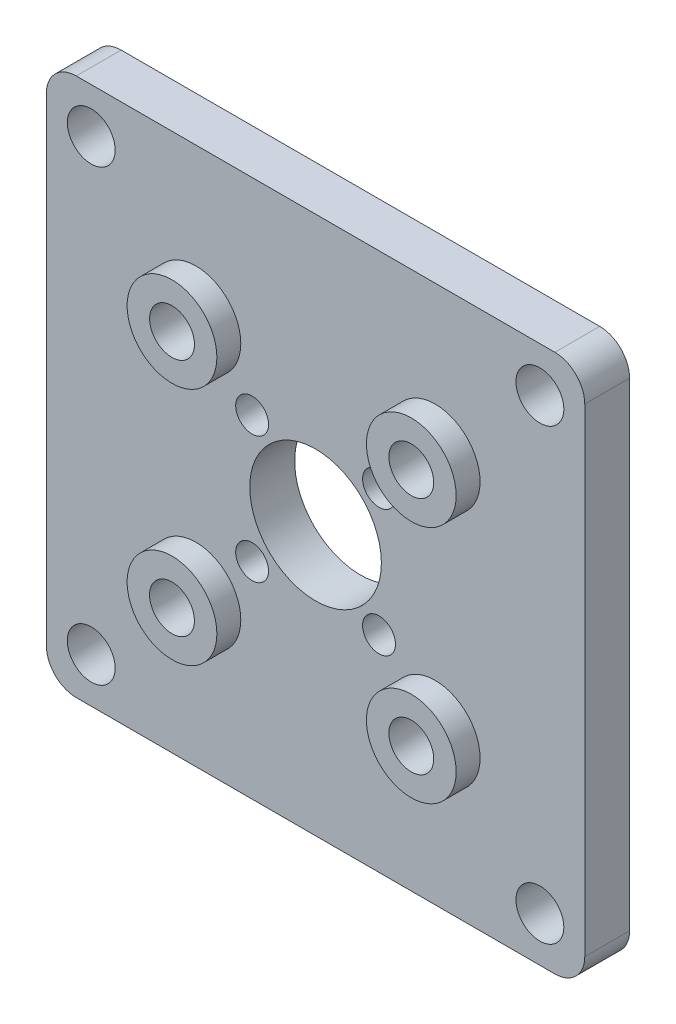
from build123d import *

# Parameters (mm, degrees)
ESQUISSE1_W             = 36
ESQUISSE1_H             = 36
ESQUISSE1_R             = 1.1
ESQUISSE1_R_2           = 4.4
ESQUISSE1_R_3           = 1.6
BOSS_EXTRU_1_DEPTH      = 3
ESQUISSE2_R             = 3
BOSS_EXTRU_2_DEPTH      = 1.6
ESQUISSE3_R             = 1.5
ENL_V_MAT_EXTRU_1_DEPTH = 26.868127107
CONG_1_R                = 2


with BuildPart() as part:
    # Esquisse1 → Boss.-Extru.1 (new body)
    with BuildSketch(Plane.XY):
        Rectangle(ESQUISSE1_W, ESQUISSE1_H)
        with Locations((-4.242640687, 4.242640687)):
            Circle(ESQUISSE1_R, mode=Mode.SUBTRACT)
        with Locations((4.242640687, 4.242640687)):
            Circle(ESQUISSE1_R, mode=Mode.SUBTRACT)
        with Locations((4.242640687, -4.242640687)):
            Circle(ESQUISSE1_R, mode=Mode.SUBTRACT)
        with Locations((-4.242640687, -4.242640687)):
            Circle(ESQUISSE1_R, mode=Mode.SUBTRACT)
        Circle(ESQUISSE1_R_2, mode=Mode.SUBTRACT)
        with Locations((-15, 15)):
            Circle(ESQUISSE1_R_3, mode=Mode.SUBTRACT)
        with Locations((15, 15)):
            Circle(ESQUISSE1_R_3, mode=Mode.SUBTRACT)
        with Locations((15, -15)):
            Circle(ESQUISSE1_R_3, mode=Mode.SUBTRACT)
        with Locations((-15, -15)):
            Circle(ESQUISSE1_R_3, mode=Mode.SUBTRACT)
    extrude(amount=BOSS_EXTRU_1_DEPTH)

    # Esquisse2 → Boss.-Extru.2 (add)
    with BuildSketch(Plane.XY.offset(3)):
        with Locations((-8, 8)):
            Circle(ESQUISSE2_R)
        with Locations((8, 8)):
            Circle(ESQUISSE2_R)
        with Locations((8, -8)):
            Circle(ESQUISSE2_R)
        with Locations((-8, -8)):
            Circle(ESQUISSE2_R)
    extrude(amount=BOSS_EXTRU_2_DEPTH)

    # Esquisse3 → Enlèv. mat.-Extru.1 (cut, through all)
    with BuildSketch(Plane.XY.offset(4.6)):
        with Locations((-8, 8)):
            Circle(ESQUISSE3_R)
        with Locations((8, 8)):
            Circle(ESQUISSE3_R)
        with Locations((8, -8)):
            Circle(ESQUISSE3_R)
        with Locations((-8, -8)):
            Circle(ESQUISSE3_R)
    extrude(amount=-ENL_V_MAT_EXTRU_1_DEPTH, mode=Mode.SUBTRACT)

    # Congé1
    cong_1_edges = [part.edges().sort_by_distance(p)[0] for p in [
        (-18, 18, 1.5),
        (-18, -18, 1.5),
        (18, -18, 1.5),
        (18, 18, 1.5),
    ]]
    fillet(cong_1_edges, radius=CONG_1_R)


solid = part.part
